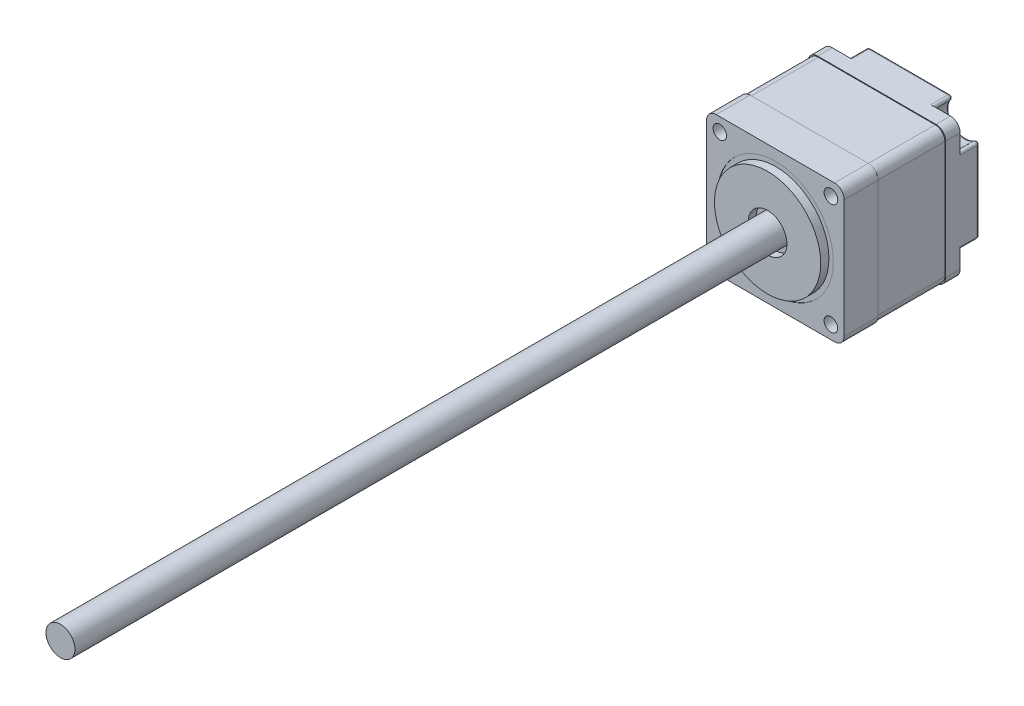
from build123d import *

# Parameters (mm, degrees)
SKETCH1_W           = 28.5
SKETCH1_H           = 28.5
BOSS_EXTRUDE1_DEPTH = 7
FILLET1_R           = 2
SKETCH2_R           = 11
BOSS_EXTRUDE2_DEPTH = 1.6
SKETCH3_R           = 4
CUT_EXTRUDE1_DEPTH  = 1.6
SKETCH6_W           = 28.2
SKETCH6_H           = 28.2
BOSS_EXTRUDE4_DEPTH = 14
FILLET2_R           = 2
SKETCH7_W           = 28.5
SKETCH7_H           = 28.5
BOSS_EXTRUDE5_DEPTH = 7
FILLET3_R           = 2
SKETCH9_R           = 1.4
CUT_EXTRUDE3_DEPTH  = 42.7
SKETCH10_R          = 3.5
CUT_EXTRUDE4_DEPTH  = 4
FILLET4_R           = 0.5
FILLET5_R           = 0.5
CUT_EXTRUDE5_START  = -0.1
SKETCH11_R          = 12
SKETCH11_R_2        = 11
CUT_EXTRUDE5_DEPTH  = 0.1
CUT_EXTRUDE6_START  = -2.5
SKETCH12_R          = 4
CUT_EXTRUDE6_DEPTH  = 2.5
SKETCH13_R          = 2.5
BOSS_EXTRUDE7_DEPTH = 0.5
FILLET6_R           = 0.2
SKETCH_1_R          = 3
SHAFT_DEPTH         = 148


with BuildPart() as part:
    # Sketch1 → Boss-Extrude1 (new body)
    with BuildSketch(Plane.XY):
        Rectangle(SKETCH1_W, SKETCH1_H)
    extrude(amount=BOSS_EXTRUDE1_DEPTH)

    # Fillet1
    fillet1_edges = [part.edges().sort_by_distance(p)[0] for p in [
        (14.25, -14.25, 3.5),
        (-14.25, -14.25, 3.5),
        (-14.25, 14.25, 3.5),
        (14.25, 14.25, 3.5),
    ]]
    fillet(fillet1_edges, radius=FILLET1_R)

    # Sketch2 → Boss-Extrude2 (add)
    with BuildSketch(Plane.XY.offset(7)):
        Circle(SKETCH2_R)
    extrude(amount=BOSS_EXTRUDE2_DEPTH)

    # Sketch3 → Cut-Extrude1 (cut)
    with BuildSketch(Plane.XY.offset(8.6)):
        Circle(SKETCH3_R)
    extrude(amount=-CUT_EXTRUDE1_DEPTH, mode=Mode.SUBTRACT)

    # Sketch6 → Boss-Extrude4 (add)
    with BuildSketch(Plane(origin=(0, 0, 0), x_dir=(-1, 0, 0), z_dir=(0, 0, -1))):
        Rectangle(SKETCH6_W, SKETCH6_H)
    extrude(amount=BOSS_EXTRUDE4_DEPTH)

    # Fillet2
    # the kernel refuses this fillet: 2 mm, written as the material it takes off along each edge
    with BuildSketch(Plane(origin=(-14.1, -14.1, 0), x_dir=(0, 1, 0), z_dir=(0, 0, -1)), Plane(origin=(-14.1, 14.1, 0), x_dir=(1, 0, 0), z_dir=(0, 0, -1))) as fillet2_piece_1:
        with BuildLine():
            CenterArc((FILLET2_R, FILLET2_R), FILLET2_R, 180, 90)
            Line((0, FILLET2_R), (0, 0))
            Line((0, 0), (FILLET2_R, 0))
        make_face()
    extrude(amount=19, mode=Mode.SUBTRACT)
    with BuildSketch(Plane(origin=(14.1, 14.1, 0), x_dir=(-1, 0, 0), z_dir=(0, 0, -1)), Plane(origin=(14.1, -14.1, 0), x_dir=(0, 1, 0), z_dir=(0, 0, -1))) as fillet2_piece_2:
        with BuildLine():
            CenterArc((FILLET2_R, -FILLET2_R), FILLET2_R, 90, 90)
            Line((0, -FILLET2_R), (0, 0))
            Line((0, 0), (FILLET2_R, 0))
        make_face()
    extrude(amount=19, mode=Mode.SUBTRACT)

    # Sketch7 → Boss-Extrude5 (add)
    with BuildSketch(Plane(origin=(0, 0, -14), x_dir=(-1, 0, 0), z_dir=(0, 0, -1))):
        Rectangle(SKETCH7_W, SKETCH7_H)
    extrude(amount=BOSS_EXTRUDE5_DEPTH)

    # Fillet3
    fillet3_edges = [part.edges().sort_by_distance(p)[0] for p in [
        (-14.25, -14.25, -17.5),
        (-14.25, 14.25, -17.5),
        (14.25, 14.25, -17.5),
        (14.25, -14.25, -17.5),
    ]]
    fillet(fillet3_edges, radius=FILLET3_R)

    # Sketch9 → Cut-Extrude3 (cut)
    with BuildSketch(Plane.XY.offset(7)):
        with Locations((-11.5, 11.5)):
            Circle(SKETCH9_R)
        with Locations((11.5, 11.5)):
            Circle(SKETCH9_R)
        with Locations((11.5, -11.5)):
            Circle(SKETCH9_R)
        with Locations((-11.5, -11.5)):
            Circle(SKETCH9_R)
    extrude(amount=-CUT_EXTRUDE3_DEPTH, mode=Mode.SUBTRACT)

    # Sketch10 → Cut-Extrude4 (cut)
    with BuildSketch(Plane(origin=(0, 0, -21), x_dir=(-1, 0, 0), z_dir=(0, 0, -1))):
        with Locations((-11.5, 11.5)):
            Circle(SKETCH10_R)
        with Locations((11.5, 11.5)):
            Circle(SKETCH10_R)
        with Locations((11.5, -11.5)):
            Circle(SKETCH10_R)
        with Locations((-11.5, -11.5)):
            Circle(SKETCH10_R)
    extrude(amount=-CUT_EXTRUDE4_DEPTH, mode=Mode.SUBTRACT)

    # Fillet4
    fillet4_edges = [part.edges().sort_by_distance(p)[0] for p in [
        (14.25, -9.334936491, -19),
        (9.334936491, -14.25, -19),
        (-14.25, -9.334936491, -19),
        (-9.334936491, -14.25, -19),
        (-14.25, 9.334936491, -19),
        (-9.334936491, 14.25, -19),
        (9.334936491, 14.25, -19),
        (14.25, 9.334936491, -19),
    ]]
    fillet(fillet4_edges, radius=FILLET4_R)

    # Fillet5
    fillet5_edges = [part.edges().sort_by_distance(p)[0] for p in [
        (-14.25, 0, -21),
        (9.025126266, -9.025126266, -21),
        (0, -14.25, -21),
        (-9.025126266, -9.025126266, -21),
        (-9.025126266, 9.025126266, -21),
        (0, 14.25, -21),
        (9.025126266, 9.025126266, -21),
        (14.25, 0, -21),
        (13.983853587, 8.634752599, -21),
        (8.634752599, 13.983853587, -21),
        (13.983853587, -8.634752599, -21),
        (8.634752599, -13.983853587, -21),
        (-8.634752599, -13.983853587, -21),
        (-13.983853587, -8.634752599, -21),
        (-8.634752599, 13.983853587, -21),
        (-13.983853587, 8.634752599, -21),
    ]]
    fillet(fillet5_edges, radius=FILLET5_R)

    # Sketch11 → Cut-Extrude5 (cut)
    with BuildSketch(Plane.XY.offset(7).offset(CUT_EXTRUDE5_START)):
        Circle(SKETCH11_R)
        Circle(SKETCH11_R_2, mode=Mode.SUBTRACT)
    extrude(amount=CUT_EXTRUDE5_DEPTH, mode=Mode.SUBTRACT)

    # Sketch12 → Cut-Extrude6 (cut)
    with BuildSketch(Plane(origin=(0, 0, -21), x_dir=(-1, 0, 0), z_dir=(0, 0, -1)).offset(CUT_EXTRUDE6_START)):
        with Locations(Location((0, 0, 0), (0, 0, 180))):
            Circle(SKETCH12_R)
    extrude(amount=CUT_EXTRUDE6_DEPTH, mode=Mode.SUBTRACT)

    # Sketch13 → Boss-Extrude7 (add)
    with BuildSketch(Plane(origin=(0, 0, -18.5), x_dir=(-1, 0, 0), z_dir=(0, 0, -1))):
        Circle(SKETCH13_R)
    extrude(amount=BOSS_EXTRUDE7_DEPTH)

    # Fillet6
    fillet6_edges = [part.edges().sort_by_distance(p)[0] for p in [
        (2.5, 0, -19),
    ]]
    fillet(fillet6_edges, radius=FILLET6_R)

    # Эскиз1 → Shaft (add)
    with BuildSketch(Plane.XY.offset(7)):
        Circle(SKETCH_1_R)
    extrude(amount=SHAFT_DEPTH)


solid = part.part
